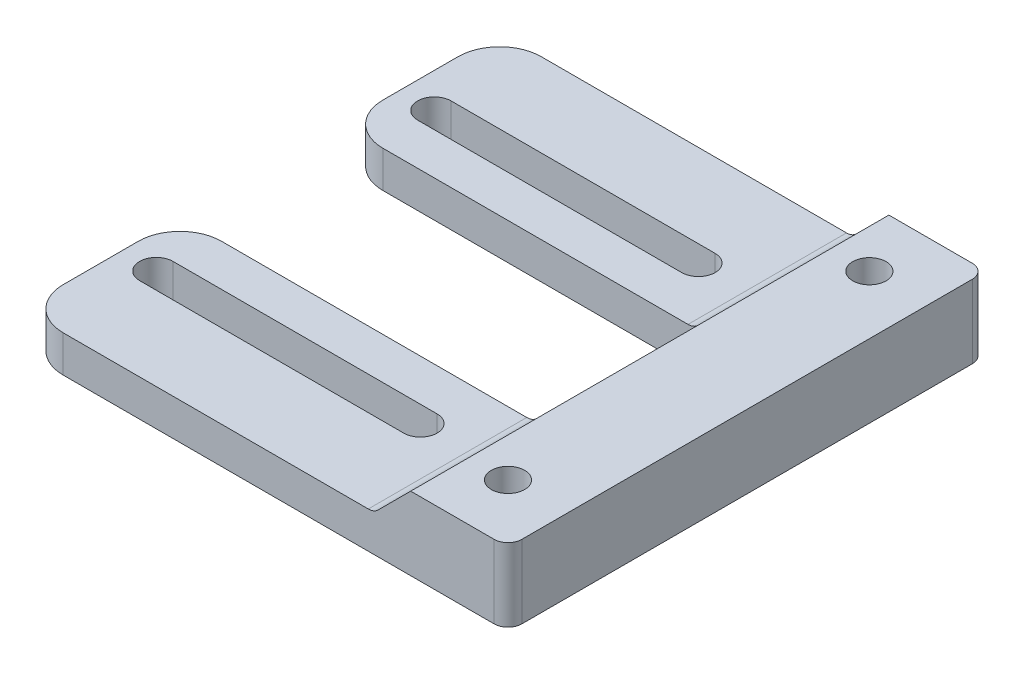
from build123d import *

# Parameters (mm, degrees)
SKETCH1_W           = 7
SKETCH1_H           = 2.635
BOSS_EXTRUDE1_DEPTH = 17.2
CUT_EXTRUDE1_REACH  = 41.352
SKETCH2_R           = 1.2
CUT_EXTRUDE2_REACH  = 41.087
SKETCH3_W           = 28
SKETCH3_H           = 11.6
CHAMFER1_SIZE       = 2.635
FILLET2_R           = 1
FILLET3_R           = 3
FILLET4_R           = 1


with BuildPart() as part:
    # Sketch1 → Boss-Extrude1 (new, symmetric)
    with BuildSketch(Plane.XY):
        Polygon((0, -5.27), (0, -2.635), (-7, -2.635), (-35, -2.635), (-35, -5.27), align=None)
        with Locations((-3.5, -1.3175)):
            Rectangle(SKETCH1_W, SKETCH1_H)
    extrude(amount=BOSS_EXTRUDE1_DEPTH, both=True)

    # Sketch2 → Cut-Extrude1 (cut, up to next)
    with BuildSketch(Plane(origin=(0, 0, 0), x_dir=(1, 0, 0), z_dir=(0, 1, 0)), mode=Mode.PRIVATE) as cut_extrude1_sk1:
        with Locations(Location((-4.2, 13, 0), (0, 0, 270))):
            Circle(SKETCH2_R)
    cut_extrude1_tool1 = extrude(cut_extrude1_sk1.sketch, amount=-CUT_EXTRUDE1_REACH, mode=Mode.PRIVATE) & part.part
    # Sketch2 → Cut-Extrude1 (cut, up to next)
    with BuildSketch(Plane(origin=(0, 0, 0), x_dir=(1, 0, 0), z_dir=(0, 1, 0)), mode=Mode.PRIVATE) as cut_extrude1_sk2:
        with Locations(Location((-4.2, -13, 0), (0, 0, 270))):
            Circle(SKETCH2_R)
    cut_extrude1_tool2 = extrude(cut_extrude1_sk2.sketch, amount=-CUT_EXTRUDE1_REACH, mode=Mode.PRIVATE) & part.part
    add(cut_extrude1_tool1.solids().sort_by_distance((-4.2, 0, -13))[0], mode=Mode.SUBTRACT)
    add(cut_extrude1_tool2.solids().sort_by_distance((-4.2, 0, 13))[0], mode=Mode.SUBTRACT)

    # Sketch3 → Cut-Extrude2 (cut, up to next)
    with BuildSketch(Plane(origin=(0, -2.635, 0), x_dir=(1, 0, 0), z_dir=(0, 1, 0)), mode=Mode.PRIVATE) as cut_extrude2_sk1:
        with Locations((-21, 0)):
            Rectangle(SKETCH3_W, SKETCH3_H)
    cut_extrude2_tool1 = extrude(cut_extrude2_sk1.sketch, amount=-CUT_EXTRUDE2_REACH, mode=Mode.PRIVATE) & part.part
    # Sketch3 → Cut-Extrude2 (cut, up to next)
    with BuildSketch(Plane(origin=(0, -2.635, 0), x_dir=(1, 0, 0), z_dir=(0, 1, 0)), mode=Mode.PRIVATE) as cut_extrude2_sk2:
        with BuildLine():
            Line((-32.5, 11.2), (-13.5, 11.2))
            ThreePointArc((-13.5, 11.2), (-12.3, 10), (-13.5, 8.8))
            Line((-13.5, 8.8), (-32.5, 8.8))
            ThreePointArc((-32.5, 8.8), (-33.7, 10), (-32.5, 11.2))
        make_face()
    cut_extrude2_tool2 = extrude(cut_extrude2_sk2.sketch, amount=-CUT_EXTRUDE2_REACH, mode=Mode.PRIVATE) & part.part
    # Sketch3 → Cut-Extrude2 (cut, up to next)
    with BuildSketch(Plane(origin=(0, -2.635, 0), x_dir=(1, 0, 0), z_dir=(0, 1, 0)), mode=Mode.PRIVATE) as cut_extrude2_sk3:
        with BuildLine():
            Line((-32.5, -8.8), (-13.5, -8.8))
            ThreePointArc((-13.5, -8.8), (-12.3, -10), (-13.5, -11.2))
            Line((-13.5, -11.2), (-32.5, -11.2))
            ThreePointArc((-32.5, -11.2), (-33.7, -10), (-32.5, -8.8))
        make_face()
    cut_extrude2_tool3 = extrude(cut_extrude2_sk3.sketch, amount=-CUT_EXTRUDE2_REACH, mode=Mode.PRIVATE) & part.part
    add(cut_extrude2_tool1.solids().sort_by_distance((-21, -2.635, 0))[0], mode=Mode.SUBTRACT)
    add(cut_extrude2_tool2.solids().sort_by_distance((-23, -2.635, -10))[0], mode=Mode.SUBTRACT)
    add(cut_extrude2_tool3.solids().sort_by_distance((-23, -2.635, 10))[0], mode=Mode.SUBTRACT)

    # Chamfer1
    # the kernel refuses this chamfer: 2.635 mm, written as the material it adds along each edge
    with BuildSketch(Plane(origin=(-7, -2.635, 5.8), x_dir=(0.027495876610586358, 0.9996219169112968, 0), z_dir=(0, 0, 1))) as chamfer1_piece_1_section:
        Polygon((CHAMFER1_SIZE * 0.999621916911, CHAMFER1_SIZE * 0.0274958766106), (-CHAMFER1_SIZE * 0.0274958766106, CHAMFER1_SIZE * 0.999621916911), (0, 0), align=None)
    chamfer1_piece_1 = extrude(amount=11.4, mode=Mode.PRIVATE)
    chamfer1_piece_1 = split(chamfer1_piece_1, bisect_by=Plane(origin=(-7.870614947, 0, 11.5), z_dir=(0, -1, 0)), keep=Keep.TOP, mode=Mode.PRIVATE)
    add(chamfer1_piece_1)
    with BuildSketch(Plane(origin=(-7, -2.635, -17.2), x_dir=(0.027495876610586358, 0.9996219169112968, 0), z_dir=(0, 0, 1))) as chamfer1_piece_2_section:
        Polygon((CHAMFER1_SIZE * 0.999621916911, CHAMFER1_SIZE * 0.0274958766106), (-CHAMFER1_SIZE * 0.0274958766106, CHAMFER1_SIZE * 0.999621916911), (0, 0), align=None)
    chamfer1_piece_2 = extrude(amount=11.4, mode=Mode.PRIVATE)
    chamfer1_piece_2 = split(chamfer1_piece_2, bisect_by=Plane(origin=(-7.870614947, 0, -11.5), z_dir=(0, -1, 0)), keep=Keep.TOP, mode=Mode.PRIVATE)
    add(chamfer1_piece_2)

    # Fillet2
    fillet2_edges = [part.edges().sort_by_distance(p)[0] for p in [
        (-7, -2.635, -5.8),
        (-7, -2.635, 5.8),
        (-9.635, -2.635, 11.5),
        (-9.635, -2.635, -11.5),
    ]]
    fillet(fillet2_edges, radius=FILLET2_R)

    # Fillet3
    fillet3_edges = [part.edges().sort_by_distance(p)[0] for p in [
        (-35, -3.9525, -17.2),
        (-35, -3.9525, 17.2),
        (-35, -3.9525, 5.8),
        (-35, -3.9525, -5.8),
    ]]
    fillet(fillet3_edges, radius=FILLET3_R)

    # Fillet4
    fillet4_edges = [part.edges().sort_by_distance(p)[0] for p in [
        (0, -2.635, 17.2),
        (0, -2.635, -17.2),
    ]]
    fillet(fillet4_edges, radius=FILLET4_R)


solid = part.part
